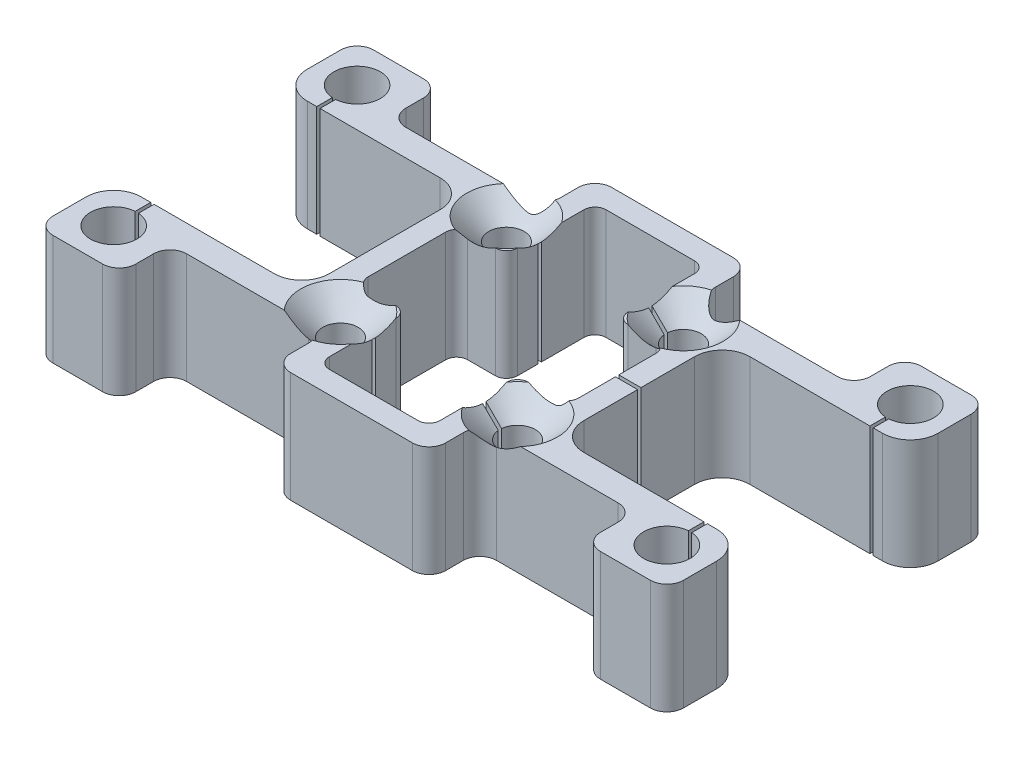
from build123d import *

# Parameters (mm, degrees)
SKETCH_1_R          = 2.100000000000001
EXTRUDE_1_DEPTH     = 10
FILLET_1_R          = 1.5
SKETCH_2_R          = 1.6000000000000019
CUT_EXTRUDE_1_DEPTH = 10
CUT_EXTRUDE_2_DEPTH = 10
FILLET_2_R          = 2.5
CHAMFER_1_SIZE      = 2
CUT_EXTRUDE_3_DEPTH = 10
FILLET_3_R          = 1
SKETCH_5_W          = 4.217423160443628
SKETCH_5_H          = 0.3
CUT_EXTRUDE_5_DEPTH = 10
CUT_EXTRUDE_6_DEPTH = 10
FILLET_4_R          = 1.5
SKETCH_7_W          = 0.2999999999999936
SKETCH_7_H          = 4.581766567774286
CUT_EXTRUDE_7_DEPTH = 10
SKETCH_8_W          = 3.858887416181922
SKETCH_8_H          = 0.2999999999999998
CUT_EXTRUDE_8_DEPTH = 10


with BuildPart() as part:
    # 草图1 → 凸台-拉伸1 (new body)
    with BuildSketch(Plane(origin=(0, 0, 0), x_dir=(1, 0, 0), z_dir=(0, 1, 0))):
        Polygon((-28.499999999999982, 14.5), (28.499999999999996, 14.5), (28.500000000000004, -14.499999999999995), (-28.499999999999975, -14.499999999999995), align=None)
        with Locations((-25.000000000000004, 11.000000000000002)):
            Circle(SKETCH_1_R, mode=Mode.SUBTRACT)
        with Locations((-25, -10.999999999999998)):
            Circle(SKETCH_1_R, mode=Mode.SUBTRACT)
        with Locations((24.999999999999996, 11.000000000000002)):
            Circle(SKETCH_1_R, mode=Mode.SUBTRACT)
        with Locations((24.999999999999996, -10.999999999999998)):
            Circle(SKETCH_1_R, mode=Mode.SUBTRACT)
    extrude(amount=EXTRUDE_1_DEPTH)

    # 圆角1
    fillet_1_edges = [part.edges().sort_by_distance(p)[0] for p in [
        (-28.499999999999982, 5, -14.5),
        (-28.499999999999975, 5, 14.499999999999995),
        (28.499999999999996, 5, -14.5),
        (28.500000000000004, 5, 14.499999999999995),
    ]]
    fillet(fillet_1_edges, radius=FILLET_1_R)

    # 草图2 → 切除-拉伸1 (cut)
    with BuildSketch(Plane(origin=(0, 10, 0), x_dir=(1, 0, 0), z_dir=(0, 1, 0))):
        with Locations((7.999999999999998, 7.500000000000002)):
            Circle(SKETCH_2_R)
        with Locations((-8.000000000000002, 7.500000000000002)):
            Circle(SKETCH_2_R)
        with Locations((-8, -7.499999999999998)):
            Circle(SKETCH_2_R)
        with Locations((7.999999999999998, -7.499999999999998)):
            Circle(SKETCH_2_R)
    extrude(amount=-CUT_EXTRUDE_1_DEPTH, mode=Mode.SUBTRACT)

    # 草图3 → 切除-拉伸2 (cut)
    with BuildSketch(Plane(origin=(0, 10, 0), x_dir=(1, 0, 0), z_dir=(0, 1, 0))):
        Polygon((28.500000000000004, -7.500000000000002), (11.500000000000004, -7.500000000000004), (11.500000000000004, 7.500000000000004), (28.500000000000004, 7.500000000000002), align=None)
        Polygon((-28.500000000000004, 7.500000000000002), (-11.500000000000004, 7.500000000000004), (-11.500000000000004, -7.500000000000004), (-28.500000000000004, -7.500000000000002), align=None)
    extrude(amount=-CUT_EXTRUDE_2_DEPTH, mode=Mode.SUBTRACT)

    # 圆角2
    fillet_2_edges = [part.edges().sort_by_distance(p)[0] for p in [
        (-28.500000000000004, 5, -7.500000000000002),
        (-28.500000000000004, 5, 7.500000000000002),
        (-11.500000000000004, 5, 7.500000000000004),
        (-11.500000000000004, 5, -7.500000000000004),
        (28.500000000000004, 5, 7.500000000000002),
        (11.500000000000004, 5, 7.500000000000004),
        (11.500000000000004, 5, -7.500000000000004),
        (28.500000000000004, 5, -7.500000000000002),
    ]]
    fillet(fillet_2_edges, radius=FILLET_2_R)

    # 倒角1
    chamfer_1_edges = [part.edges().sort_by_distance(p)[0] for p in [
        (6.399999999999997, 10, -7.500000000000001),
        (6.399999999999997, 10, 7.499999999999999),
        (-9.600000000000001, 10, 7.499999999999999),
        (-9.600000000000003, 10, -7.500000000000001),
    ]]
    chamfer(chamfer_1_edges, length=CHAMFER_1_SIZE)

    # 草图4 → 切除-拉伸3 (cut)
    with BuildSketch(Plane.XZ):
        Polygon((-5.000000000000001, 12.499999999999991), (5.000000000000001, 12.499999999999993), (4.999999999999998, 4.499999999999998), (9.500000000000002, 4.499999999999998), (9.500000000000002, -4.499999999999998), (5, -4.499999999999999), (5.000000000000001, -12.499999999999993), (-5.000000000000001, -12.499999999999991), (-4.999999999999995, -4.5), (-9.499999999999998, -4.499999999999996), (-9.499999999999998, 4.499999999999996), (-4.9999999999999964, 4.499999999999997), align=None)
    extrude(amount=-CUT_EXTRUDE_3_DEPTH, mode=Mode.SUBTRACT)

    # 圆角3
    fillet_3_edges = [part.edges().sort_by_distance(p)[0] for p in [
        (-4.9999999999999964, 5, 4.499999999999997),
        (-9.499999999999998, 4.8770509831248425, 4.499999999999996),
        (-9.499999999999998, 4.8770509831248425, -4.499999999999996),
        (-4.999999999999995, 5, -4.5),
        (-5.000000000000001, 5, -12.499999999999991),
        (5.000000000000001, 5, -12.499999999999993),
        (5, 5, -4.499999999999999),
        (9.500000000000002, 4.877050983124844, -4.499999999999998),
        (9.500000000000002, 4.8770509831248425, 4.499999999999998),
        (4.999999999999998, 5, 4.499999999999998),
        (5.000000000000001, 5, 12.499999999999993),
        (-5.000000000000001, 5, 12.499999999999991),
    ]]
    fillet(fillet_3_edges, radius=FILLET_3_R)

    # 草图5 → 切除-拉伸5 (cut)
    with BuildSketch(Plane.XZ):
        with Locations((10.500000000000004, -3e-17)):
            Rectangle(SKETCH_5_W, SKETCH_5_H)
    extrude(amount=-CUT_EXTRUDE_5_DEPTH, mode=Mode.SUBTRACT)

    # 草图6 → 切除-拉伸6 (cut)
    with BuildSketch(Plane.XZ):
        Polygon((6.999999999999998, 14.499999999999995), (20.999999999999993, 14.499999999999995), (21, 9.899999999999997), (7, 9.899999999999995), align=None)
        Polygon((20.999999999999993, -14.499999999999995), (21, -9.899999999999997), (7, -9.899999999999995), (6.999999999999998, -14.499999999999995), align=None)
        Polygon((-6.999999999999991, -14.499999999999996), (-20.999999999999993, -14.499999999999991), (-20.999999999999993, -9.900000000000002), (-6.999999999999995, -9.899999999999997), align=None)
        Polygon((-20.999999999999993, 14.499999999999991), (-20.999999999999993, 9.900000000000002), (-6.999999999999995, 9.899999999999997), (-6.999999999999991, 14.499999999999996), align=None)
    extrude(amount=-CUT_EXTRUDE_6_DEPTH, mode=Mode.SUBTRACT)

    # 圆角4
    fillet_4_edges = [part.edges().sort_by_distance(p)[0] for p in [
        (-20.999999999999993, 5, -14.499999999999991),
        (-20.999999999999993, 5, -9.900000000000002),
        (-6.999999999999995, 4.499999999999999, -9.899999999999997),
        (-6.999999999999991, 5, -14.499999999999996),
        (6.999999999999998, 5, -14.499999999999995),
        (7, 4.499999999999996, -9.899999999999995),
        (21, 5, -9.899999999999997),
        (20.999999999999993, 5, -14.499999999999995),
        (20.999999999999993, 5, 14.499999999999995),
        (6.999999999999998, 5, 14.499999999999995),
        (7, 4.499999999999997, 9.899999999999995),
        (21, 5, 9.899999999999997),
        (-6.999999999999991, 5, 14.499999999999996),
        (-6.999999999999995, 4.499999999999998, 9.899999999999997),
        (-20.999999999999993, 5, 9.900000000000002),
        (-20.999999999999993, 5, 14.499999999999991),
    ]]
    fillet(fillet_4_edges, radius=FILLET_4_R)

    # 草图7 → 切除-拉伸7 (cut)
    with BuildSketch(Plane(origin=(0, 10, 0), x_dir=(1, 0, 0), z_dir=(0, 1, 0))):
        with Locations((25, -9.25)):
            Rectangle(SKETCH_7_W, SKETCH_7_H)
        with Locations((25, 9.25)):
            Rectangle(SKETCH_7_W, SKETCH_7_H)
        Polygon((-24.85, -11.540883283887137), (-24.85, -6.959116716112852), (-25.15, -6.9591167161128515), (-25.15, -11.540883283887137), align=None)
        Polygon((-25.15, 11.540883283887137), (-25.15, 6.9591167161128515), (-24.85, 6.959116716112852), (-24.85, 11.540883283887137), align=None)
    extrude(amount=-CUT_EXTRUDE_7_DEPTH, mode=Mode.SUBTRACT)

    # 草图8 → 切除-拉伸8 (cut)
    with BuildSketch(Plane.XZ):
        Polygon((-8.429443708090963, -7.349999999999995), (-4.570556291909043, -7.349999999999997), (-4.570556291909043, -7.649999999999997), (-8.429443708090963, -7.649999999999995), align=None)
        with Locations((-6.500000000000002, 7.4999999999999964)):
            Rectangle(SKETCH_8_W, SKETCH_8_H)
        Polygon((8.429443708090963, -7.649999999999995), (8.429443708090963, -7.349999999999995), (4.570556291909043, -7.349999999999997), (4.570556291909043, -7.649999999999997), align=None)
        with Locations((6.500000000000002, 7.4999999999999964)):
            Rectangle(SKETCH_8_W, SKETCH_8_H)
    extrude(amount=-CUT_EXTRUDE_8_DEPTH, mode=Mode.SUBTRACT)


solid = part.part
